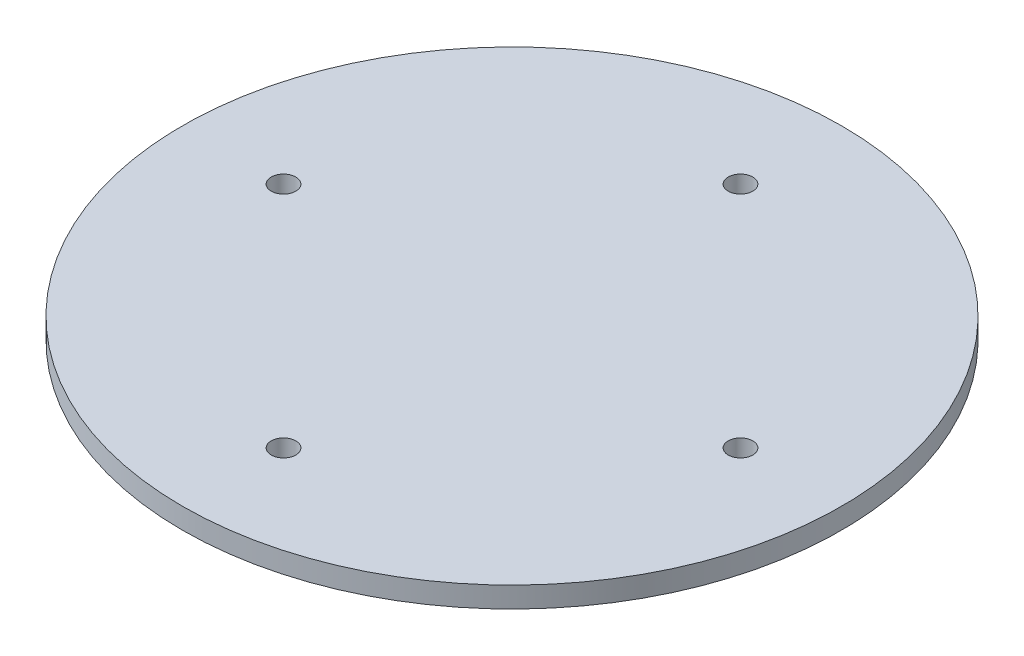
from build123d import *

# Parameters (mm, degrees)
SKETCH1_R           = 47.625
BOSS_EXTRUDE1_DEPTH = 3
SKETCH3_R           = 1.778
CUT_EXTRUDE1_DEPTH  = 68.418701041
CIRPATTERN1_COUNT   = 4


with BuildPart() as part:
    # Sketch1 → Boss-Extrude1 (new body)
    with BuildSketch(Plane(origin=(0, 0, 0), x_dir=(1, 0, 0), z_dir=(0, 1, 0))):
        Circle(SKETCH1_R)
    extrude(amount=BOSS_EXTRUDE1_DEPTH)

    # Sketch3 → Cut-Extrude1 (cut, through all)
    with BuildSketch(Plane(origin=(0, 3, 0), x_dir=(1, 0, 0), z_dir=(0, 1, 0))):
        with Locations((33.02, 0)):
            Circle(SKETCH3_R)
    cut_extrude1 = extrude(amount=-CUT_EXTRUDE1_DEPTH, mode=Mode.SUBTRACT)

    # CirPattern1: Cut-Extrude1 ×4 about axis
    cirpattern1_axis = Axis((0, 3, 0), (0, -1, 0))
    for i in range(1, CIRPATTERN1_COUNT):
        add(cut_extrude1.rotate(cirpattern1_axis, i * 360 / CIRPATTERN1_COUNT), mode=Mode.SUBTRACT)


solid = part.part
